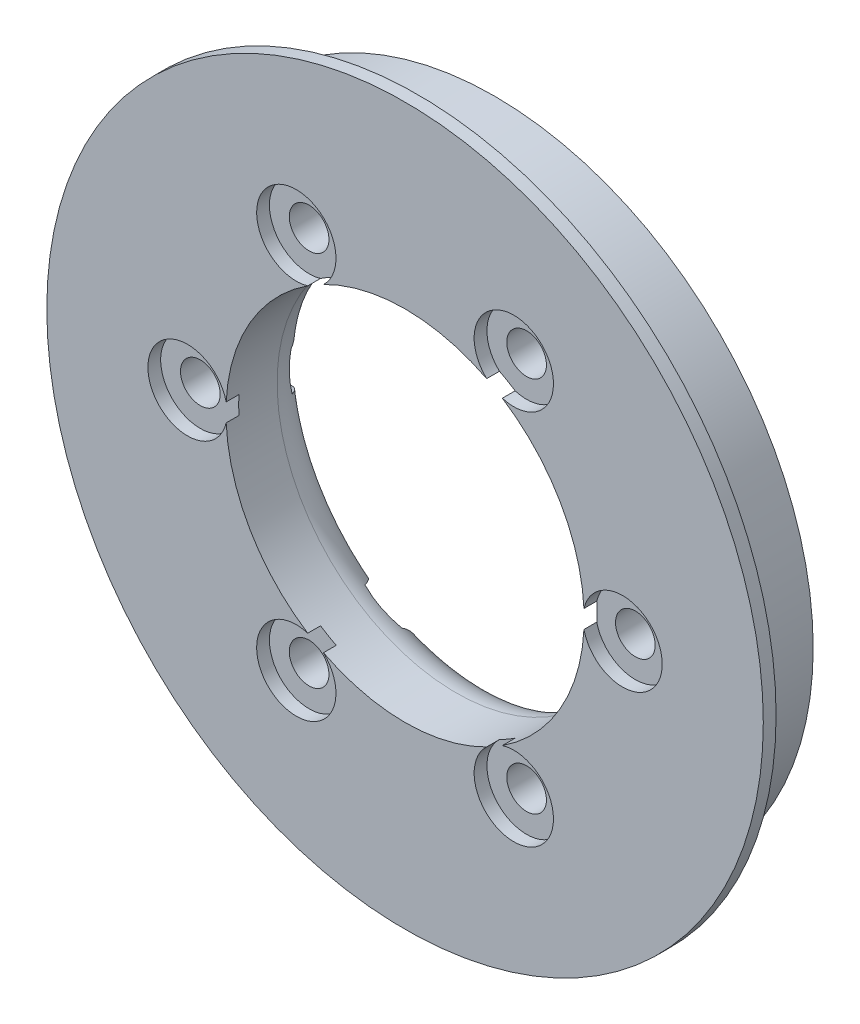
from build123d import *

# Parameters (mm, degrees)
SKETCH_1_R          = 24.9
SKETCH_1_R_2        = 14
EXTRUDE_1_DEPTH     = 7
SKETCH_3_R          = 1.55
CUT_EXTRUDE_2_DEPTH = 10
SKETCH_4_R          = 3.1
CUT_EXTRUDE_3_DEPTH = 1
EXTRUDE_START       = -1
SKETCH_6_R          = 28
SKETCH_6_R_2        = 24.9
EXTRUDE_2_DEPTH     = 1
CUT_EXTRUDE_4_DEPTH = 2.8
FILLET_1_R          = 3


with BuildPart() as part:
    # 草图1 → 凸台-拉伸1 (new body)
    with BuildSketch(Plane.XY):
        Circle(SKETCH_1_R)
        Circle(SKETCH_1_R_2, mode=Mode.SUBTRACT)
    extrude(amount=EXTRUDE_1_DEPTH)

    # 草图3 → 切除-拉伸2 (cut)
    with BuildSketch(Plane(origin=(0, 0, 0), x_dir=(-1, 0, 0), z_dir=(0, 0, -1))):
        with Locations((8.5, -14.722431864)):
            Circle(SKETCH_3_R)
        with Locations((-8.5, -14.722431864)):
            Circle(SKETCH_3_R)
        with Locations((-17, 0)):
            Circle(SKETCH_3_R)
        with Locations((-8.5, 14.722431864)):
            Circle(SKETCH_3_R)
        with Locations((17, 0)):
            Circle(SKETCH_3_R)
        with Locations((8.5, 14.722431864)):
            Circle(SKETCH_3_R)
    extrude(amount=-CUT_EXTRUDE_2_DEPTH, mode=Mode.SUBTRACT)

    # 草图4 → 切除-拉伸3 (cut)
    with BuildSketch(Plane.XY.offset(7)):
        with Locations((17, 0)):
            Circle(SKETCH_4_R)
        with Locations((8.5, -14.722431864)):
            Circle(SKETCH_4_R)
        with Locations((-8.5, -14.722431864)):
            Circle(SKETCH_4_R)
        with Locations((-17, 0)):
            Circle(SKETCH_4_R)
        with Locations((-8.5, 14.722431864)):
            Circle(SKETCH_4_R)
        with Locations((8.5, 14.722431864)):
            Circle(SKETCH_4_R)
    extrude(amount=-CUT_EXTRUDE_3_DEPTH, mode=Mode.SUBTRACT)

    # 草图6 → 凸台-拉伸2 (add)
    with BuildSketch(Plane.XY.offset(7).offset(EXTRUDE_START)):
        Circle(SKETCH_6_R)
        Circle(SKETCH_6_R_2, mode=Mode.SUBTRACT)
    extrude(amount=EXTRUDE_2_DEPTH)

    # 草图7 → 切除-拉伸4 (cut)
    with BuildSketch(Plane(origin=(0, 0, 0), x_dir=(-1, 0, 0), z_dir=(0, 0, -1))):
        Polygon((8.575410724, -17.896962783), (11.286929783, -16.244389721), (11.211519059, -13.069858802), (8.424589276, -11.547900945), (5.713070217, -13.200474007), (5.788480941, -16.375004926), align=None)
        Polygon((19.786929783, -1.521957857), (19.711519059, 1.652573062), (16.924589276, 3.174530919), (14.213070217, 1.521957857), (14.288480941, -1.652573062), (17.075410724, -3.174530919), align=None)
        Polygon((-11.211519059, -16.375004926), (-8.424589276, -17.896962783), (-5.713070217, -16.244389721), (-5.788480941, -13.069858802), (-8.575410724, -11.547900945), (-11.286929783, -13.200474007), align=None)
        Polygon((-19.786929783, 1.521957857), (-19.711519059, -1.652573062), (-16.924589276, -3.174530919), (-14.213070217, -1.521957857), (-14.288480941, 1.652573062), (-17.075410724, 3.174530919), align=None)
        Polygon((-8.575410724, 17.896962783), (-11.286929783, 16.244389721), (-11.211519059, 13.069858802), (-8.424589276, 11.547900945), (-5.713070217, 13.200474007), (-5.788480941, 16.375004926), align=None)
        Polygon((11.211519059, 16.375004926), (8.424589276, 17.896962783), (5.713070217, 16.244389721), (5.788480941, 13.069858802), (8.575410724, 11.547900945), (11.286929783, 13.200474007), align=None)
    extrude(amount=-CUT_EXTRUDE_4_DEPTH, mode=Mode.SUBTRACT)

    # 圆角1
    # the kernel refuses this fillet: 3 mm, written as the material it takes off along each edge
    with BuildSketch(Plane(origin=(0, 0, 0), x_dir=(1, 0, 0), z_dir=(0, -1, 0))) as fillet_1_piece_1:
        with BuildLine():
            CenterArc((14 + FILLET_1_R, FILLET_1_R), FILLET_1_R, 180, 90)
            Line((14, FILLET_1_R), (14, 0))
            Line((14, 0), (14 + FILLET_1_R, 0))
        make_face()
    revolve(axis=Axis((0, 0, 0), (0, 0, 1)), mode=Mode.SUBTRACT)


solid = part.part
